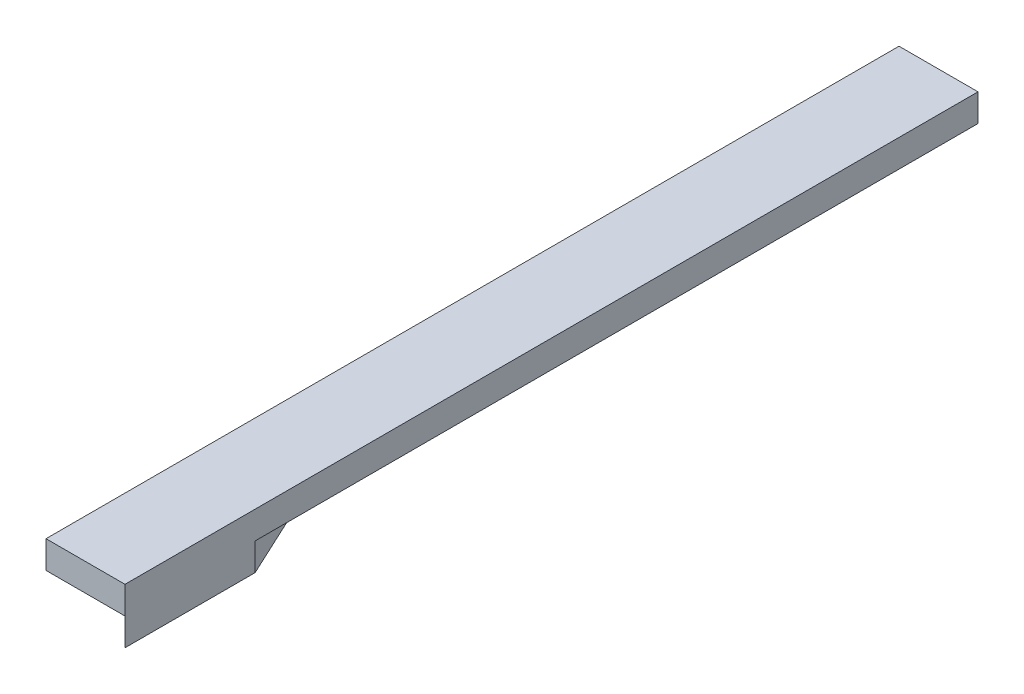
from build123d import *

# Parameters (mm, degrees)
BOSS_EXTRUDE1_DEPTH = 5
BOSS_EXTRUDE2_START = -5
BOSS_EXTRUDE2_DEPTH = 5


# Read off the part's stored shape, not the designer's step: Boss-Extrude2
with BuildPart() as part:
    # Sketch1 → Boss-Extrude1 (new body)
    with BuildSketch(Plane(origin=(0, 0, 0), x_dir=(1, 0, 0), z_dir=(0, 1, 0))):
        Polygon((14.359671821, -155.090990788), (0, -124.296575192), (0, -155.090990788), align=None)
        Polygon((0, -100.63455936), (0, -124.296575192), (14.359671821, -155.090990788), (14.359671821, -131.428974957), align=None)
        Polygon((0, 0), (0, -100.63455936), (14.359671821, -131.428974957), (14.359671821, 0), align=None)
    extrude(amount=BOSS_EXTRUDE1_DEPTH)

    # Boss-Extrude2 outline → Boss-Extrude2 (add)
    with BuildSketch(Plane(origin=(0, 0, 0), x_dir=(1, 0, 0), z_dir=(0, 1, 0)).offset(BOSS_EXTRUDE2_START)):
        Polygon((0, -100.63455936), (0, -124.296575192), (14.359671821, -155.090990788), (14.359671821, -131.428974957), align=None)
    extrude(amount=BOSS_EXTRUDE2_DEPTH)


solid = part.part
